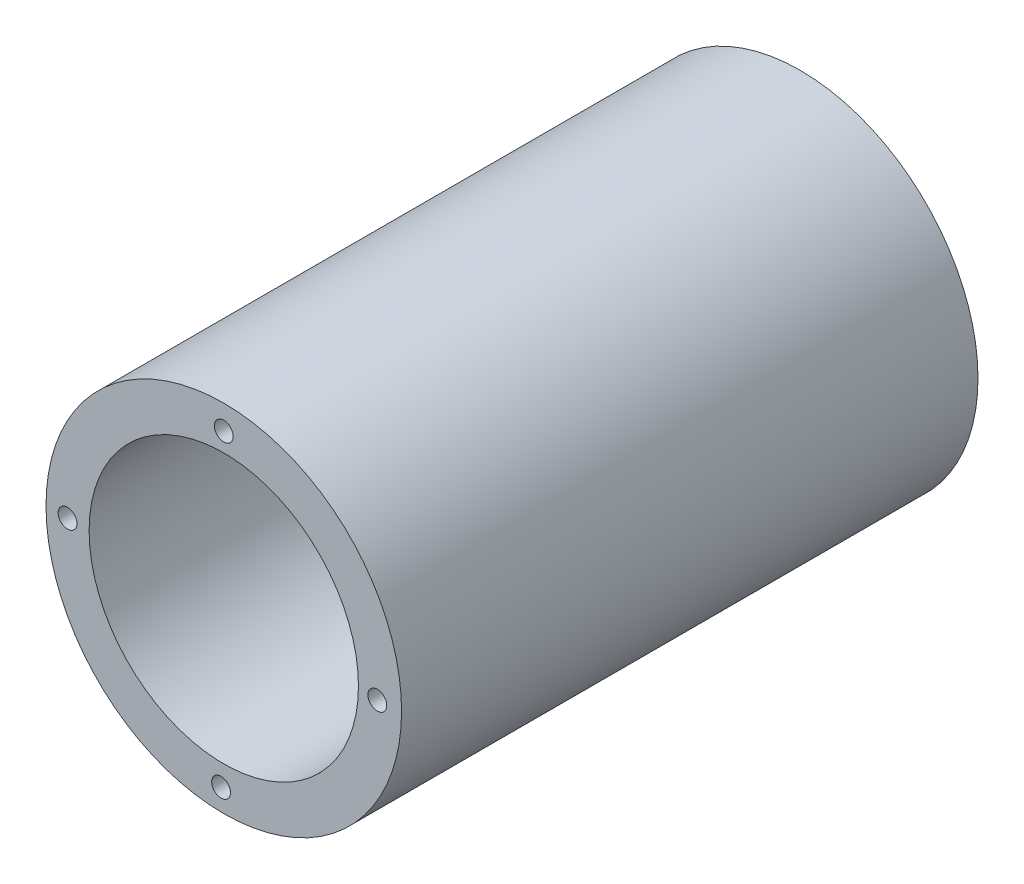
from build123d import *

# Parameters (mm, degrees)
CROQUIS1_R          = 33
CROQUIS1_R_2        = 25
BOSS_EXTRUDE1_DEPTH = 107
SKETCH1_R           = 1.5
CUT_EXTRUDE1_DEPTH  = 5
SKETCH2_R           = 1.75
CUT_EXTRUDE2_DEPTH  = 5


with BuildPart() as part:
    # Croquis1 → Boss-Extrude1 (new body)
    with BuildSketch(Plane.XY):
        Circle(CROQUIS1_R)
        Circle(CROQUIS1_R_2, mode=Mode.SUBTRACT)
    extrude(amount=BOSS_EXTRUDE1_DEPTH)

    # Sketch1 → Cut-Extrude1 (cut)
    with BuildSketch(Plane(origin=(0, 0, 0), x_dir=(-1, 0, 0), z_dir=(0, 0, -1))):
        with Locations((-29, 0)):
            Circle(SKETCH1_R)
        with Locations((0, 29)):
            Circle(SKETCH1_R)
        with Locations((29, 0)):
            Circle(SKETCH1_R)
        with Locations((0, -29)):
            Circle(SKETCH1_R)
    extrude(amount=-CUT_EXTRUDE1_DEPTH, mode=Mode.SUBTRACT)

    # Sketch2 → Cut-Extrude2 (cut)
    with BuildSketch(Plane.XY.offset(107)):
        with Locations((-29, 0)):
            Circle(SKETCH2_R)
        with Locations((0, 28.5)):
            Circle(SKETCH2_R)
        with Locations((28.5, -0.5)):
            Circle(SKETCH2_R)
        with Locations((-0.5, -29)):
            Circle(SKETCH2_R)
    extrude(amount=-CUT_EXTRUDE2_DEPTH, mode=Mode.SUBTRACT)


solid = part.part
